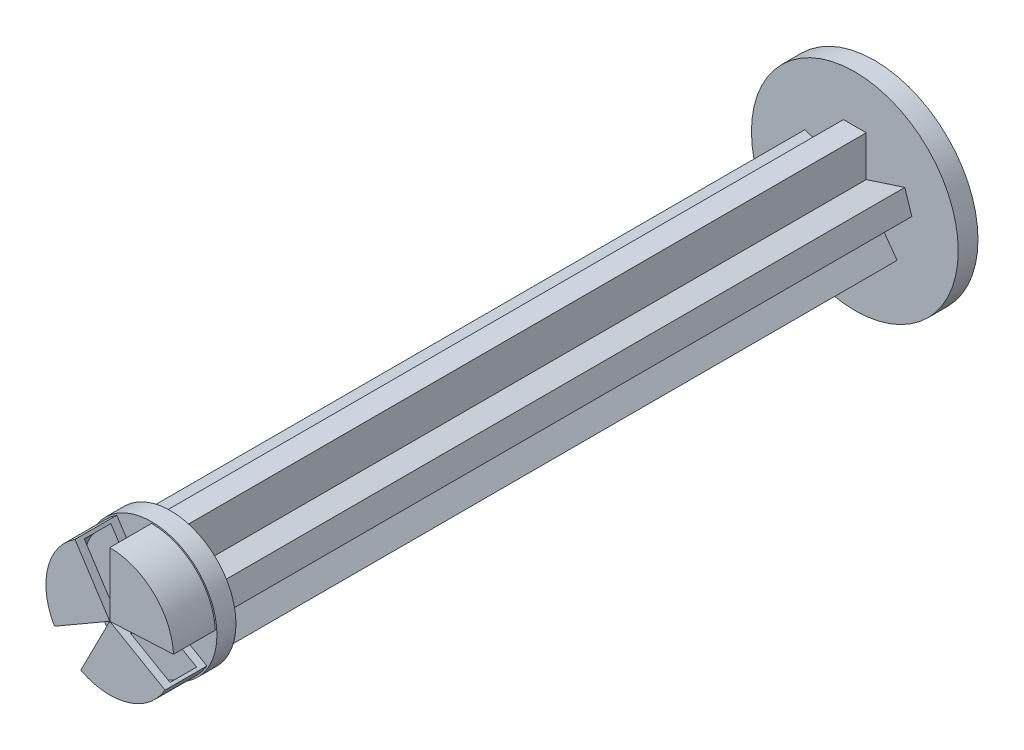
from build123d import *

# Parameters (mm, degrees)
EXTRU_MINCE1_DEPTH      = 3
EXTRU_MINCE1_2_DEPTH    = 3
EXTRU_MINCE1_3_DEPTH    = 3
BOSS_EXTRU_1_DEPTH      = 0.25
BOSS_EXTRU_1_DEPTH_BACK = 1
ESQUISSE3_R             = 4.3
ESQUISSE3_R_2           = 0.05
ESQUISSE4_W             = 1.75
ESQUISSE4_H             = 3
EXTRU_MINCE2_DEPTH      = 45
CONG_1_R                = 0.2
ESQUISSE6_R             = 6.8
BOSS_EXTRU_2_DEPTH      = 1.3


# Read off the part's stored shape, not the designer's step: Extru.-Mince2
with BuildPart() as part:
    # Esquisse2 → Extru.-Mince1 (new body)
    with BuildSketch(Plane.XY):
        with BuildLine():
            ThreePointArc((0, 4.2), (2.89149518, 3.046187063), (4.194302481, 0.218693153))
            Line((4.194302481, 0.218693153), (0.049932172, 0.00260349))
            ThreePointArc((0.049932172, 0.00260349), (0.034422562, 0.036264132), (0, 0.05))
            Line((0, 0.05), (0, 4.2))
        make_face()
    extrude(amount=EXTRU_MINCE1_DEPTH)



with BuildPart() as body_2:
    # Esquisse2 → Extru.-Mince1 2 (new body)
    with BuildSketch(Plane.XY):
        with BuildLine():
            ThreePointArc((3.637306696, -2.1), (1.192327791, -4.027201813), (-1.907757414, -3.741719077))
            Line((-1.907757414, -3.741719077), (-0.022711398, -0.044544275))
            ThreePointArc((-0.022711398, -0.044544275), (0.014194378, -0.047942879), (0.04330127, -0.025))
            Line((0.04330127, -0.025), (3.637306696, -2.1))
        make_face()
    extrude(amount=EXTRU_MINCE1_2_DEPTH)


with BuildPart() as body_3:
    # Esquisse2 → Extru.-Mince1 3 (new body)
    with BuildSketch(Plane.XY):
        with BuildLine():
            ThreePointArc((-3.637306696, -2.1), (-4.083822971, 0.98101475), (-2.286545067, 3.523025923))
            Line((-2.286545067, 3.523025923), (-0.027220775, 0.041940785))
            ThreePointArc((-0.027220775, 0.041940785), (-0.04861694, 0.011678747), (-0.04330127, -0.025))
            Line((-0.04330127, -0.025), (-3.637306696, -2.1))
        make_face()
    extrude(amount=EXTRU_MINCE1_3_DEPTH)


with BuildPart() as part_1:
    add(part.part)

    add(body_2.part)  # Boss.-Extru.1 merges body 2

    add(body_3.part)  # Boss.-Extru.1 merges body 3
    # Esquisse3 → Boss.-Extru.1 (add, two sides: drawn at the far end of the back side and taken through both)
    # profile 1 of 2: a face of its own
    with BuildSketch(Plane.XY.offset(-BOSS_EXTRU_1_DEPTH_BACK)):
        Circle(ESQUISSE3_R)
        Circle(ESQUISSE3_R_2, mode=Mode.SUBTRACT)
    # profile 2 of 2: a face of its own
    with BuildSketch(Plane.XY.offset(-BOSS_EXTRU_1_DEPTH_BACK)):
        Circle(ESQUISSE3_R_2)
    extrude(amount=BOSS_EXTRU_1_DEPTH + BOSS_EXTRU_1_DEPTH_BACK)

    # Esquisse4 → Enlèvement de matière-Révolution1 (revolve, cut)
    with BuildSketch(Plane(origin=(0, 0, 0), x_dir=(0, 0, -1), z_dir=(1, 0, 0)), mode=Mode.PRIVATE) as enl_vement_de_mati_re_r_volution1_sk:
        with Locations((-1.625, 2.5)):
            Rectangle(ESQUISSE4_W, ESQUISSE4_H)
    revolve(enl_vement_de_mati_re_r_volution1_sk.sketch.rotate(Axis((0, 0, 0), (0, 0, 1)), 270), axis=Axis((0, 0, 0), (0, 0, 1)), mode=Mode.SUBTRACT)

    # Extru.-Mince2 outline → Extru.-Mince2 (add)
    with BuildSketch(Plane(origin=(0, 0, -1), x_dir=(-1, 0, 0), z_dir=(0, 0, -1))):
        Polygon((0.75, 1.03228644), (0.75, 3.7), (-0.75, 3.7), (-0.75, 1.03228644), (-3.287146365, 1.856655266), (-3.750671856, 0.430070492), (-1.213525492, -0.394298334), (-2.781568179, -2.55252394), (-1.568042688, -3.434201818), (0, -1.275976213), (1.568042688, -3.434201818), (2.781568179, -2.55252394), (1.213525492, -0.394298334), (3.750671856, 0.430070492), (3.287146365, 1.856655266), align=None)
    extrude(amount=EXTRU_MINCE2_DEPTH)

    # Congé1
    cong_1_edges = [part_1.edges().sort_by_distance(p)[0] for p in [
        (1.997546836, -1.473411137, -1),
        (2.018573182, 1.444470853, -1),
        (-2.482098674, 0.017886079, -1),
        (2.482098674, 0.017886079, -1),
        (3.518909111, 1.143362879, -1),
        (0.75, 2.36614322, -1),
        (0, 3.7, -1),
        (-2.018573182, 1.444470853, -1),
        (-3.51890911, 1.143362879, -1),
        (-1.997546836, -1.473411137, -1),
        (-2.174805433, -2.993362879, -1),
        (0.784021344, -2.355089015, -1),
        (2.174805433, -2.993362879, -1),
        (-0.75, 2.36614322, -1),
        (-0.784021344, -2.355089015, -1),
    ]]
    fillet(cong_1_edges, radius=CONG_1_R)

    # Esquisse6 → Boss.-Extru.2 (add)
    with BuildSketch(Plane(origin=(0, 0, -46), x_dir=(-1, 0, 0), z_dir=(0, 0, -1))):
        Circle(ESQUISSE6_R)
    extrude(amount=BOSS_EXTRU_2_DEPTH)


solid = part_1.part
